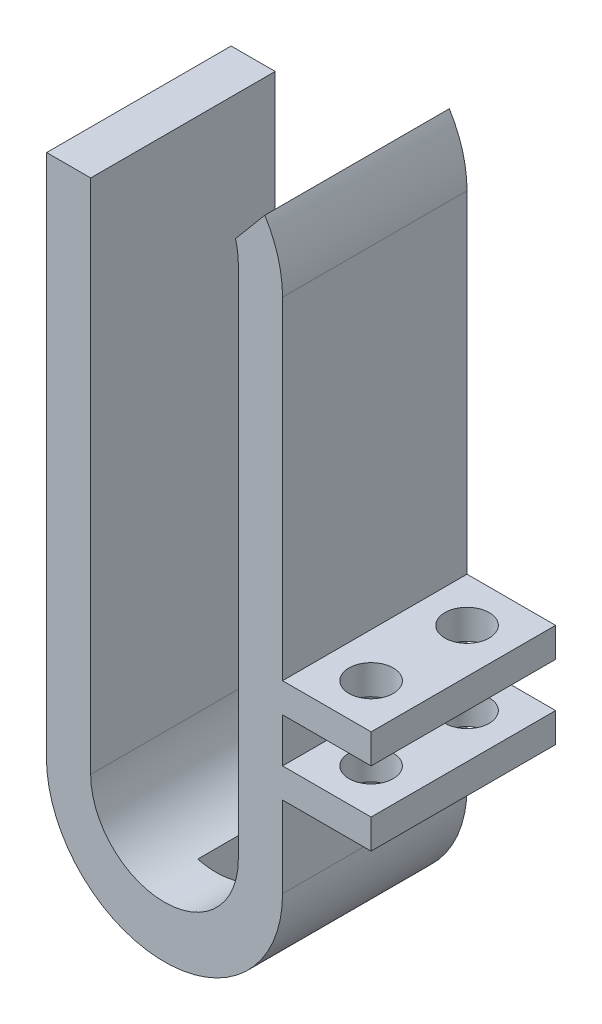
from build123d import *

# Parameters (mm, degrees)
BOSS_EXTRUDE1_DEPTH     = 12.5
SKETCH2_W               = 12.5
SKETCH2_H               = 2
BOSS_EXTRUDE2_DEPTH     = 6
CUT_EXTRUDE1_DEPTH      = 37.851366616
CUT_EXTRUDE1_DEPTH_BACK = 37.851366616
SKETCH3_R               = 1.5
SKETCH5_W               = 2.5
SKETCH5_H               = 5.5
CUT_EXTRUDE2_DEPTH      = 33.066337353


with BuildPart() as part:
    # Sketch1 → Boss-Extrude1 (new body)
    with BuildSketch(Plane.XY):
        with BuildLine():
            ThreePointArc((8, 17), (7.694207367, 19.190701486), (6.80020675, 21.213927878))
            Line((6.80020675, 21.213927878), (4.814885895, 18.847914617))
            ThreePointArc((4.814885895, 18.847914617), (4.953505298, 18.180283222), (5, 17.5))
            Line((5, 17.5), (5, -17.5))
            ThreePointArc((5, -17.5), (0, -22.5), (-5, -17.5))
            Line((-5, -17.5), (-5, 17.5))
            Line((-5, 17.5), (-7.984359711, 17.5))
            ThreePointArc((-7.984359711, 17.5), (-7.996088972, 17.250122279), (-8, 17))
            Line((-8, 17), (-8, -17.999999662))
            ThreePointArc((-8, -17.999999662), (-1.69e-07, -25.999999831), (8, -18))
            Line((8, -18), (8, 17))
        make_face()
    extrude(amount=BOSS_EXTRUDE1_DEPTH)

    # Sketch2 → Boss-Extrude2 (add)
    with BuildSketch(Plane(origin=(8, 0, 0), x_dir=(0, 0, -1), z_dir=(1, 0, 0))):
        with Locations((-6.25, -11.5)):
            Rectangle(SKETCH2_W, SKETCH2_H)
        with Locations((-6.25, -6.5)):
            Rectangle(SKETCH2_W, SKETCH2_H)
    extrude(amount=BOSS_EXTRUDE2_DEPTH)

    # Sketch3 → Cut-Extrude1 (cut, two sides: drawn at the far end of the back side and taken through both)
    with BuildSketch(Plane(origin=(0, -10.5, 0), x_dir=(1, 0, 0), z_dir=(0, 1, 0)).offset(-CUT_EXTRUDE1_DEPTH_BACK)):
        with Locations((11, -3)):
            Circle(SKETCH3_R)
        with Locations((11, -9.5)):
            Circle(SKETCH3_R)
    extrude(amount=CUT_EXTRUDE1_DEPTH + CUT_EXTRUDE1_DEPTH_BACK, mode=Mode.SUBTRACT)

    # Sketch5 → Cut-Extrude2 (cut, through all)
    with BuildSketch(Plane(origin=(0, 0, 0), x_dir=(1, 0, 0), z_dir=(0, 1, 0))):
        with Locations((0, -6.25)):
            Rectangle(SKETCH5_W, SKETCH5_H)
    extrude(amount=-CUT_EXTRUDE2_DEPTH, mode=Mode.SUBTRACT)


solid = part.part
